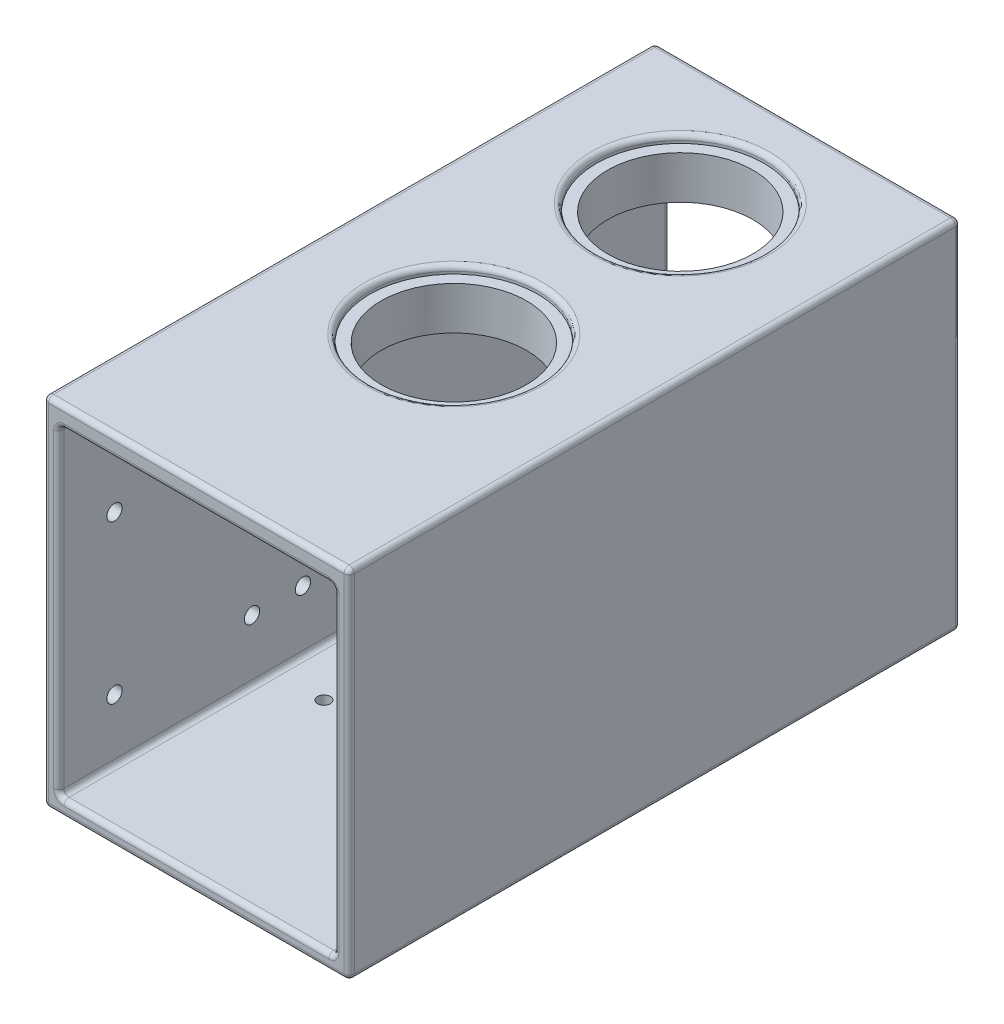
from build123d import *

# Parameters (mm, degrees)
SKETCH1_W                = 60
SKETCH1_H                = 70
BODYFRAME_DEPTH          = 120
SKETCH2_W                = 54
SKETCH2_H                = 63
SHELL_DEPTH              = 152.327459504
ARDMOUNT_OUTLINE_R       = 1.5
ARDMOUNT_DEPTH           = 3
DVRMOUNT_REACH           = 117.588
DVRMOUNT_BORE_R          = 1.5
DRVRMOUNTS_COUNT         = 2
DRVRMOUNTS_PITCH         = 27
DRVRMOUNTS_COUNT_DIR2    = 2
DRVRMOUNTS_PITCH_DIR2    = 31
STANDS_COUNT             = 2
STANDS_PITCH             = 100
STANDS_COUNT_DIR2        = 2
STANDS_PITCH_DIR2        = 50
SLIPRINGHOLE_OUTLINE_R   = 3.5
SLIPRINGHOLE_DEPTH       = 1
SLIPRINGHOLE_START       = 1
SLIPRINGHOLE_2_OUTLINE_R = 1.25
SLIPRINGHOLE_2_DEPTH     = 2
SLIPRINGHOLES_COUNT      = 2
SLIPRINGHOLES_ANGLE      = 180
MOTHOLE_OUTLINE_R        = 3.5
MOTHOLE_DEPTH            = 1
MOTHOLE_START            = 1
MOTHOLE_2_OUTLINE_R      = 1.25
MOTHOLE_2_DEPTH          = 2
MOTHOLES_COUNT           = 3
MOTHOLES_ANGLE           = 180
SKETCH15_R               = 15.2875
BEARINGSLOTS_DEPTH       = 5.925
BEARINGHOLES_D           = 28.535
BEARINGHOLES_DEPTH       = 9.925
BEARINGHOLES_CBORE_D     = 33
BEARINGHOLES_CBORE_DEPTH = 1.5
FILLET2_R                = 1
FILLET3_R                = 0.5


# Read off the part's stored shape, not the designer's step: Ardmount, SlipringHole, MotHole
with BuildPart() as part:
    # Sketch1 → BodyFrame (new body)
    with BuildSketch(Plane.XY):
        with Locations((30, 35)):
            Rectangle(SKETCH1_W, SKETCH1_H)
    extrude(amount=BODYFRAME_DEPTH)

    # Sketch2 → Shell (cut, through all)
    with BuildSketch(Plane.XY.offset(120)):
        with Locations((30, 34.5)):
            Rectangle(SKETCH2_W, SKETCH2_H)
    extrude(amount=-SHELL_DEPTH, mode=Mode.SUBTRACT)

    # Ardmount outline → Ardmount (cut)
    with BuildSketch(Plane.YZ):
        with Locations((9.92, 20)):
            Circle(ARDMOUNT_OUTLINE_R)
    ardmount = extrude(amount=ARDMOUNT_DEPTH, mode=Mode.SUBTRACT)

    # ArdMountS: Ardmount at 3 more places
    with Locations((0, 48.26, 1.27), (0, 33.02, 52.07), (0, 5.08, 52.07)):
        add(ardmount, mode=Mode.SUBTRACT)

    # DvrMount bore (on position points) → DvrMount (cut, up to next)
    with BuildSketch(Plane(origin=(0, 15, 82.07), x_dir=(0, -1, 0), z_dir=(-1, 0, 0)), mode=Mode.PRIVATE) as dvrmount_sk1:
        Circle(DVRMOUNT_BORE_R)
    dvrmount_tool1 = extrude(dvrmount_sk1.sketch, amount=-DVRMOUNT_REACH, mode=Mode.PRIVATE) & part.part
    dvrmount = dvrmount_tool1.solids().sort_by_distance((0, 15, 82.07))[0]
    add(dvrmount, mode=Mode.SUBTRACT)

    # DrvrMountS: DvrMount 2 × 2
    with Locations(*[(0, j * DRVRMOUNTS_PITCH_DIR2, i * DRVRMOUNTS_PITCH) for i in range(DRVRMOUNTS_COUNT) for j in range(DRVRMOUNTS_COUNT_DIR2) if (i, j) != (0, 0)]):
        add(dvrmount, mode=Mode.SUBTRACT)

    # Sketch6 → Stand (revolve)
    with BuildSketch(Plane(origin=(0, 0, 10), x_dir=(-1, 0, 0), z_dir=(0, 0, -1)), mode=Mode.PRIVATE) as stand_sk:
        with BuildLine():
            Line((-5, -3), (-5, 0))
            Line((-5, 0), (-2, 0))
            ThreePointArc((-2, 0), (-2.878679656, -2.121320344), (-5, -3))
        make_face()
    stand = revolve(stand_sk.sketch.rotate(Axis((5, -3, 10), (0, 1, 0)), 180), axis=Axis((5, -3, 10), (0, 1, 0)))

    # StandS: Stand 2 × 2
    with Locations(*[(j * STANDS_PITCH_DIR2, 0, i * STANDS_PITCH) for i in range(STANDS_COUNT) for j in range(STANDS_COUNT_DIR2) if (i, j) != (0, 0)]):
        add(stand)

    # SlipringHole outline → SlipringHole (cut)
    with BuildSketch(Plane(origin=(0, 0, 0), x_dir=(1, 0, 0), z_dir=(0, 1, 0))):
        with Locations((12.5, -25)):
            Circle(SLIPRINGHOLE_OUTLINE_R)
    slipringhole = extrude(amount=SLIPRINGHOLE_DEPTH, mode=Mode.SUBTRACT)

    # SlipringHole 2 outline → SlipringHole 2 (cut)
    with BuildSketch(Plane(origin=(0, 0, 0), x_dir=(1, 0, 0), z_dir=(0, 1, 0)).offset(SLIPRINGHOLE_START)):
        with Locations((12.5, -25)):
            Circle(SLIPRINGHOLE_2_OUTLINE_R)
    slipringhole_2 = extrude(amount=SLIPRINGHOLE_2_DEPTH, mode=Mode.SUBTRACT)

    # SlipringHoleS: SlipringHole, SlipringHole 2 ×2 about axis
    slipringholes_axis = Axis((30, 0, 25), (0, 1, 0))
    add([slipringhole.rotate(slipringholes_axis, i * SLIPRINGHOLES_ANGLE / (SLIPRINGHOLES_COUNT - 1)) for i in range(1, SLIPRINGHOLES_COUNT)], mode=Mode.SUBTRACT)
    add([slipringhole_2.rotate(slipringholes_axis, i * SLIPRINGHOLES_ANGLE / (SLIPRINGHOLES_COUNT - 1)) for i in range(1, SLIPRINGHOLES_COUNT)], mode=Mode.SUBTRACT)

    # MotHole outline → MotHole (cut)
    with BuildSketch(Plane(origin=(0, 0, 0), x_dir=(1, 0, 0), z_dir=(0, 1, 0))):
        with Locations((12.5, -77.45)):
            Circle(MOTHOLE_OUTLINE_R)
    mothole = extrude(amount=MOTHOLE_DEPTH, mode=Mode.SUBTRACT)

    # MotHole 2 outline → MotHole 2 (cut)
    with BuildSketch(Plane(origin=(0, 0, 0), x_dir=(1, 0, 0), z_dir=(0, 1, 0)).offset(MOTHOLE_START)):
        with Locations((12.5, -77.45)):
            Circle(MOTHOLE_2_OUTLINE_R)
    mothole_2 = extrude(amount=MOTHOLE_2_DEPTH, mode=Mode.SUBTRACT)

    # MotHoleS: MotHole, MotHole 2 ×3 about axis
    motholes_axis = Axis((30, 0, 77.45), (0, -1, 0))
    add([mothole.rotate(motholes_axis, i * MOTHOLES_ANGLE / (MOTHOLES_COUNT - 1)) for i in range(1, MOTHOLES_COUNT)], mode=Mode.SUBTRACT)
    add([mothole_2.rotate(motholes_axis, i * MOTHOLES_ANGLE / (MOTHOLES_COUNT - 1)) for i in range(1, MOTHOLES_COUNT)], mode=Mode.SUBTRACT)

    # Sketch15 → BearingSlots (add)
    with BuildSketch(Plane.XZ.offset(-66)):
        with Locations(Location((30, 25, 0), (0, 0, 90))):
            Circle(SKETCH15_R)
        with Locations(Location((30, 69.45, 0), (0, 0, 90))):
            Circle(SKETCH15_R)
    extrude(amount=BEARINGSLOTS_DEPTH)

    # BearingHoles
    with Locations(Plane(origin=(30, 70, 25), x_dir=(0, 0, 1), z_dir=(0, 1, 0))):
        with Locations((0, 0), (44.45, 0)):
            CounterBoreHole(BEARINGHOLES_D / 2, BEARINGHOLES_CBORE_D / 2, BEARINGHOLES_CBORE_DEPTH, depth=BEARINGHOLES_DEPTH)

    # Fillet2
    fillet2_edges = [part.edges().sort_by_distance(p)[0] for p in [
        (60, 35, 120),
        (30, 70, 120),
        (30, 66, 54.1625),
        (30, 66, 9.7125),
        (30, 70, 52.95),
        (30, 70, 8.5),
        (57, 34.5, 0),
        (57, 66, 60),
        (30, 3, 0),
        (57, 3, 60),
        (3, 34.5, 0),
        (3, 3, 60),
        (30, 66, 0),
        (3, 66, 60),
        (57, 34.5, 120),
        (30, 66, 120),
        (3, 34.5, 120),
        (30, 3, 120),
        (0, 35, 120),
        (30, 70, 0),
        (60, 35, 0),
        (30, 0, 0),
        (0, 35, 0),
        (30, 0, 120),
        (0, 70, 60),
        (60, 70, 60),
        (60, 0, 60),
        (0, 0, 60),
    ]]
    fillet(fillet2_edges, radius=FILLET2_R)

    # Fillet3
    fillet3_edges = [part.edges().sort_by_distance(p)[0] for p in [
        (52, 0, 110),
        (2, 0, 10),
        (52, 0, 10),
        (2, 0, 110),
    ]]
    fillet(fillet3_edges, radius=FILLET3_R)


solid = part.part
